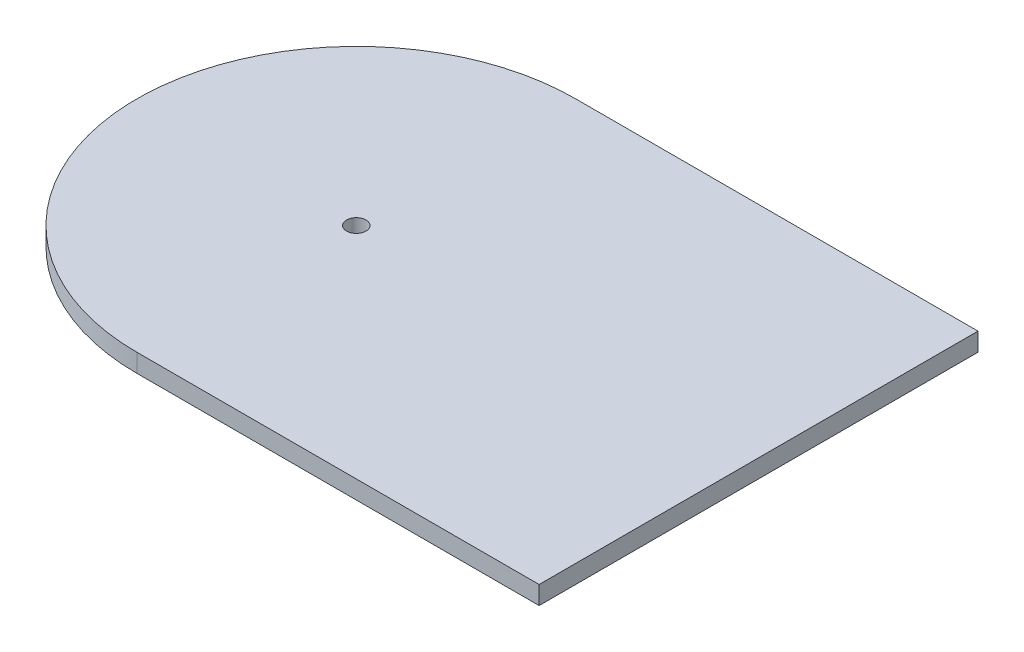
from build123d import *

# Parameters (mm, degrees)
SKETCH1_R           = 3.3655
BOSS_EXTRUDE1_DEPTH = 6.35


with BuildPart() as part:
    # Sketch1 → Boss-Extrude1 (new body)
    with BuildSketch(Plane(origin=(0, 0, 0), x_dir=(1, 0, 0), z_dir=(0, 1, 0))):
        with BuildLine():
            ThreePointArc((0, 76.2), (-76.2, 0), (0, -76.2))
            Line((0, -76.2), (139.7, -76.2))
            Line((139.7, -76.2), (139.7, 76.2))
            Line((139.7, 76.2), (0, 76.2))
        make_face()
        Circle(SKETCH1_R, mode=Mode.SUBTRACT)
    extrude(amount=BOSS_EXTRUDE1_DEPTH)


solid = part.part
